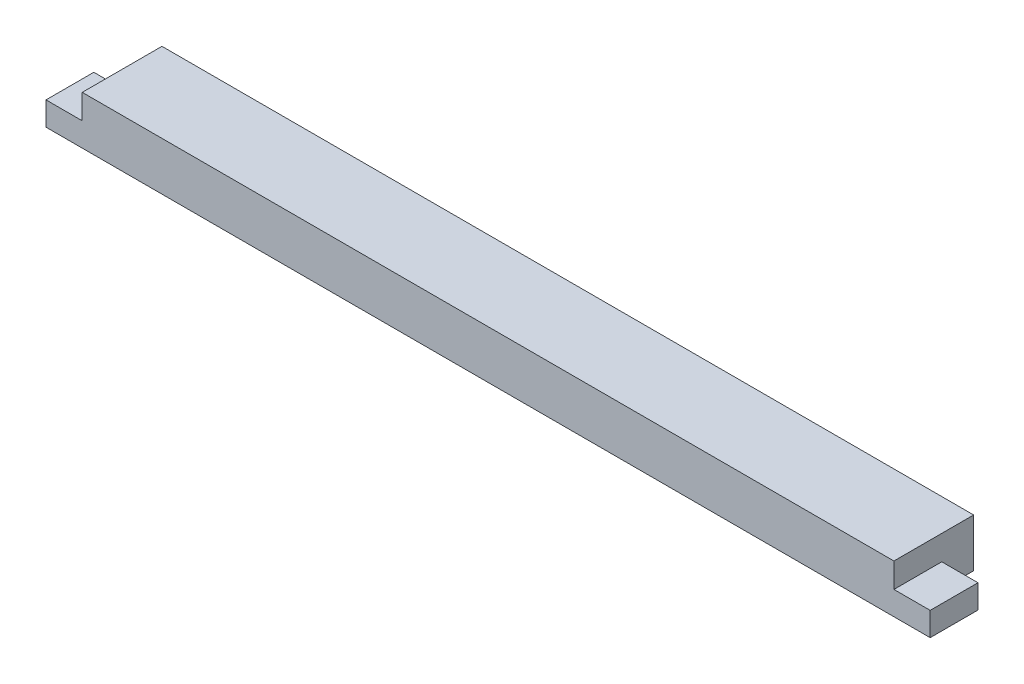
from build123d import *

# Parameters (mm, degrees)
EXTRUDE_1_DEPTH        = 26
EXTRUDE_2_DEPTH        = 19
FILLET_1_R             = 10
SKETCH_1_5_W           = 11
SKETCH_1_5_H           = 340
EXTRUDE_4_DEPTH        = 7
SKETCH_6_W             = 1.9
SKETCH_6_H             = 2
SKETCH_6_W_2           = 6.6
EXTRUDE_5_DEPTH        = 28
SKETCH_6_3_W           = 6.6
SKETCH_6_3_H           = 2
CUT_EXTRUDE_2_DEPTH    = 5
FILLET_2_R             = 20
SKETCH_6_4_W           = 15
SKETCH_6_4_H           = 10
SKETCH_6_4_H_2         = 9
EXTRUDE_6_DEPTH        = 30
SKETCH_6_5_W           = 15
SKETCH_6_5_H           = 9
EXTRUDE_7_DEPTH        = 28
EXTRUDE_8_DEPTH        = 15
FILLET_3_R             = 20
FILLET_3_OF_MIRROR_2_R = 20
FILLET_4_R             = 20
SKETCH_10_W            = 161
SKETCH_10_H            = 20
SKETCH_10_W_2          = 14
EXTRUDE_9_DEPTH        = 7
SKETCH_12_W            = 33
SKETCH_12_H            = 20
CUT_EXTRUDE_3_DEPTH    = 42
SKETCH_11_W            = 19.8
SKETCH_11_H            = 9.8
EXTRUDE_10_DEPTH       = 15


with BuildPart() as part:
    # 스케치1 → 보스-돌출1 (new body)
    with BuildSketch(Plane.XY):
        Polygon((-168, 0), (168, 0), (183, 0), (183, -340), (168, -340), (168, -20), (-168, -20), (-168, -340), (-183, -340), (-183, 0), align=None)
    extrude(amount=EXTRUDE_1_DEPTH)

    # 스케치1<4> → 보스-돌출2 (add)
    with BuildSketch(Plane.XY):
        Polygon((172, 0), (168, 0), (168, -20), (168, -340), (172, -340), align=None)
        Polygon((-168, -20), (-168, 0), (-172, 0), (-172, -340), (-168, -340), align=None)
    extrude(amount=-EXTRUDE_2_DEPTH)

    # 필렛1
    fillet_1_edges = [part.edges().sort_by_distance(p)[0] for p in [
        (170, 0, -19),
        (170, -340, -19),
        (-170, -340, -19),
        (-170, 0, -19),
    ]]
    fillet(fillet_1_edges, radius=FILLET_1_R)

    # 스케치1<5> → 보스-돌출4 (add)
    with BuildSketch(Plane.XY):
        with Locations((177.5, -170)):
            Rectangle(SKETCH_1_5_W, SKETCH_1_5_H)
        with Locations((-177.5, -170)):
            Rectangle(SKETCH_1_5_W, SKETCH_1_5_H)
    extrude(amount=-EXTRUDE_4_DEPTH)

    # 스케치6 → 보스-돌출5 (add)
    with BuildSketch(Plane.XZ.offset(340)):
        with Locations((-182.05, -6)):
            Rectangle(SKETCH_6_W, SKETCH_6_H)
        with Locations((-177.8, -6)):
            Rectangle(SKETCH_6_W_2, SKETCH_6_H)
        Polygon((-174.5, -7), (-172, -7), (-168, -7), (-168, -5), (-174.5, -5), align=None)
    extrude_5 = extrude(amount=EXTRUDE_5_DEPTH)

    # 스케치6<3> → 컷-돌출2 (cut)
    with BuildSketch(Plane.XZ.offset(340)):
        with Locations((-177.8, -6)):
            Rectangle(SKETCH_6_3_W, SKETCH_6_3_H)
    cut_extrude_2 = extrude(amount=CUT_EXTRUDE_2_DEPTH, mode=Mode.SUBTRACT)

    # 필렛2
    # the kernel refuses this fillet: 20 mm, written as the material it adds along each edge
    with BuildSketch(Plane(origin=(-172, -340, -7), x_dir=(0, -1, 0), z_dir=(1, 0, 0))) as fillet_2_piece_1:
        with BuildLine():
            CenterArc((14, 20), FILLET_2_R, 216.869897646, 53.130102354)
            Line((-2, 8), (-3.6, 6.8))
            ThreePointArc((-3.6, 6.8), (-2, 2), (-2, 0))
            Line((-2, 0), (0, -2))
            Line((0, -2), (14, -2))
            Line((14, -2), (14, 0))
        make_face()
    extrude(amount=4)

    # 스케치6<4> → 보스-돌출6 (add)
    with BuildSketch(Plane.XZ.offset(340)):
        with Locations((-175.5, 31)):
            Rectangle(SKETCH_6_4_W, SKETCH_6_4_H)
        with Locations((-175.5, 40.5)):
            Rectangle(SKETCH_6_4_W, SKETCH_6_4_H_2)
    extrude_6 = extrude(amount=-EXTRUDE_6_DEPTH)

    # 스케치6<5> → 보스-돌출7 (add)
    with BuildSketch(Plane.XZ.offset(340)):
        with Locations((-175.5, 40.5)):
            Rectangle(SKETCH_6_5_W, SKETCH_6_5_H)
    extrude_7 = extrude(amount=EXTRUDE_7_DEPTH)

    # 스케치9 → 보스-돌출8 (add)
    with BuildSketch(Plane.ZY.offset(183)):
        Polygon((26, -310), (45, -310), (26, -270), align=None)
    extrude_8 = extrude(amount=-EXTRUDE_8_DEPTH)

    # 필렛3
    fillet_3_edges = [part.edges().sort_by_distance(p)[0] for p in [
        (-175.5, -310, 45),
        (-175.5, -270, 26),
    ]]
    fillet(fillet_3_edges, radius=FILLET_3_R)

    # 대칭 복사2: 보스-돌출5, 컷-돌출2, 보스-돌출6, 보스-돌출7, 보스-돌출8 across plane
    add(extrude_5.mirror(Plane(origin=(0, 0, 0), x_dir=(0, 0, 1), z_dir=(1, 0, 0))))
    add(cut_extrude_2.mirror(Plane(origin=(0, 0, 0), x_dir=(0, 0, 1), z_dir=(1, 0, 0))), mode=Mode.SUBTRACT)
    add(extrude_6.mirror(Plane(origin=(0, 0, 0), x_dir=(0, 0, 1), z_dir=(1, 0, 0))))
    add(extrude_7.mirror(Plane(origin=(0, 0, 0), x_dir=(0, 0, 1), z_dir=(1, 0, 0))))
    add(extrude_8.mirror(Plane(origin=(0, 0, 0), x_dir=(0, 0, 1), z_dir=(1, 0, 0))))

    # 필렛3 of 대칭 복사2
    fillet_3_of_mirror_2_edges = [part.edges().sort_by_distance(p)[0] for p in [
        (175.5, -310, 45),
        (175.5, -270, 26),
    ]]
    fillet(fillet_3_of_mirror_2_edges, radius=FILLET_3_OF_MIRROR_2_R)

    # 필렛4
    # the kernel refuses this fillet: 20 mm, written as the material it adds along each edge
    with BuildSketch(Plane(origin=(172, -340, -7), x_dir=(0, -1, 0), z_dir=(-1, 0, 0))) as fillet_4_piece_1:
        with BuildLine():
            CenterArc((14, -20), FILLET_4_R, 90, 53.130102354)
            Line((-2, -8), (-3.6, -6.8))
            ThreePointArc((-3.6, -6.8), (-2, -2), (-2, 0))
            Line((-2, 0), (0, 2))
            Line((0, 2), (14, 2))
            Line((14, 2), (14, 0))
        make_face()
    extrude(amount=4)

    # 스케치10 → 보스-돌출9 (add)
    with BuildSketch(Plane(origin=(0, 0, 0), x_dir=(-1, 0, 0), z_dir=(0, 0, -1))):
        with Locations((87.5, -10)):
            Rectangle(SKETCH_10_W, SKETCH_10_H)
        with Locations((-87.5, -10)):
            Rectangle(SKETCH_10_W, SKETCH_10_H)
        with Locations((0, -10)):
            Rectangle(SKETCH_10_W_2, SKETCH_10_H)
    extrude(amount=EXTRUDE_9_DEPTH)

    # 스케치12 → 컷-돌출3 (cut)
    with BuildSketch(Plane(origin=(-168, 0, 0), x_dir=(0, 0, -1), z_dir=(1, 0, 0))):
        with BuildLine():
            ThreePointArc((-43.065550087, -305.927473868), (-44.510394688, -310.110371974), (-45, -314.508610159))
            Line((-45, -314.508610159), (-45, -368))
            Line((-45, -368), (-36, -368))
            Line((-36, -368), (-36, -340))
            Line((-36, -340), (5, -340))
            Line((5, -340), (5, -368))
            Line((5, -368), (7, -368))
            Line((7, -368), (7, -354))
            Line((7, -354), (7, -20))
            Line((7, -20), (-26, -20))
            Line((-26, -20), (-26, -265.491389841))
            ThreePointArc((-26, -265.491389841), (-26.489605312, -269.889628026), (-27.934449913, -274.072526132))
            Line((-27.934449913, -274.072526132), (-43.065550087, -305.927473868))
        make_face()
        with Locations((-9.5, -10)):
            Rectangle(SKETCH_12_W, SKETCH_12_H)
        with BuildLine():
            Line((7, 0), (7, -20))
            Line((7, -20), (7, -354))
            ThreePointArc((7, -354), (9.11145618, -345.05572809), (15, -338))
            ThreePointArc((15, -338), (17.94427191, -334.472135955), (19, -330))
            Line((19, -330), (19, -10))
            ThreePointArc((19, -10), (16.071067812, -2.928932188), (9, 0))
            Line((9, 0), (7, 0))
        make_face()
    cut_extrude_3 = extrude(amount=-CUT_EXTRUDE_3_DEPTH, mode=Mode.SUBTRACT)

    # 대칭 복사3: 컷-돌출3 across plane
    add(cut_extrude_3.mirror(Plane(origin=(0, 0, 0), x_dir=(0, 0, 1), z_dir=(1, 0, 0))), mode=Mode.SUBTRACT)

    # 스케치11 → 보스-돌출10 (add)
    with BuildSketch(Plane(origin=(183, 0, 0), x_dir=(0, 0, -1), z_dir=(1, 0, 0))):
        with Locations((-16.1, -15.1)):
            Rectangle(SKETCH_11_W, SKETCH_11_H)
    extrude_10 = extrude(amount=-EXTRUDE_10_DEPTH)

    # 대칭 복사4: 보스-돌출10 across plane
    add(extrude_10.mirror(Plane(origin=(0, 0, 0), x_dir=(0, 0, 1), z_dir=(1, 0, 0))))


solid = part.part
